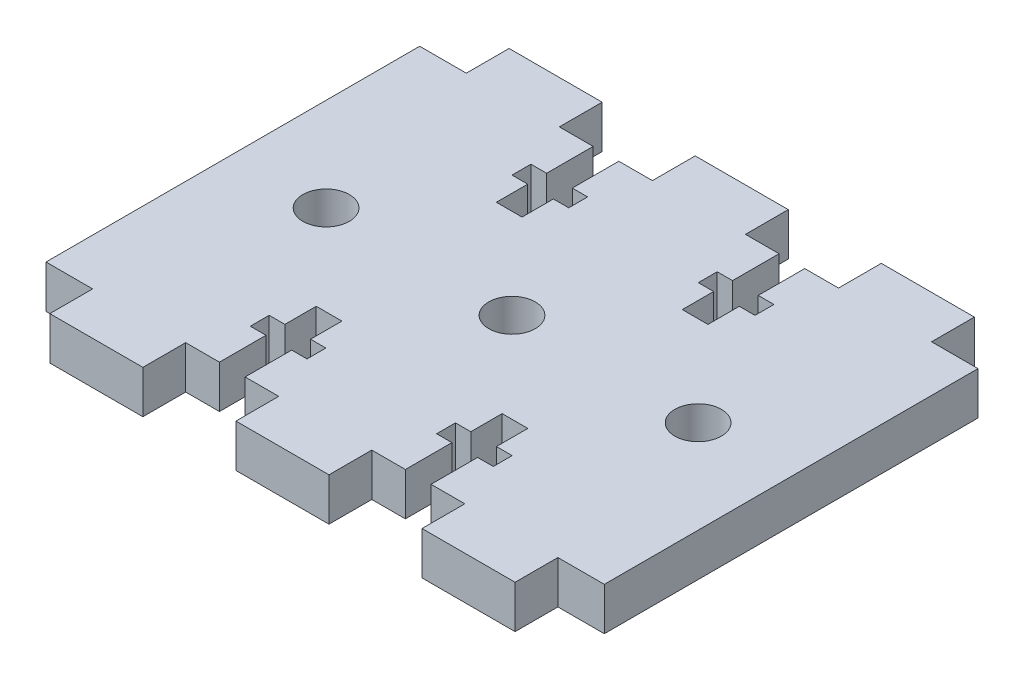
from build123d import *

# Parameters (mm, degrees)
BOSS_EXTRUDE1_DEPTH = 5.842
SKETCH2_R           = 3.175
CUT_EXTRUDE1_DEPTH  = 50.679572542


with BuildPart() as part:
    # Sketch1 → Boss-Extrude1 (new body)
    with BuildSketch(Plane(origin=(0, 0, 0), x_dir=(1, 0, 0), z_dir=(0, 1, 0))):
        Polygon((38.1, -25.5), (31.762654816, -25.5), (31.762654816, -31.342), (19.062654816, -31.342), (19.062654816, -25.5), (14.4526, -25.5), (14.4526, -19.15), (16.594059632, -19.15), (16.594059632, -16.571875), (14.4526, -16.571875), (14.4526, -12.291999784), (10.9474, -12.291999784), (10.9474, -16.571875), (8.856559632, -16.571875), (8.856559632, -19.15), (10.9474, -19.15), (10.9474, -25.5), (6.362654816, -25.5), (6.362654816, -31.342), (-6.337345184, -31.342), (-6.337345184, -25.5), (-10.922090368, -25.5), (-10.922090368, -19.15), (-8.83125, -19.15), (-8.83125, -16.571875), (-10.922090368, -16.571875), (-10.922090368, -12.291999784), (-14.427290368, -12.291999784), (-14.427290368, -16.571875), (-16.56875, -16.571875), (-16.56875, -19.15), (-14.427290368, -19.15), (-14.427290368, -25.5), (-19.037345184, -25.5), (-19.037345184, -31.342), (-31.737345184, -31.342), (-31.737345184, -25.5), (-38.1, -25.5), (-38.1, 25.5), (-31.737345184, 25.5), (-31.737345184, 31.342), (-19.037345184, 31.342), (-19.037345184, 25.5), (-14.427290368, 25.5), (-14.427290368, 19.15), (-16.56875, 19.15), (-16.56875, 16.571875), (-14.427290368, 16.571875), (-14.427290368, 12.291999784), (-10.922090368, 12.291999784), (-10.922090368, 16.571875), (-8.83125, 16.571875), (-8.83125, 19.15), (-10.922090368, 19.15), (-10.922090368, 25.5), (-6.337345184, 25.5), (-6.337345184, 31.342), (6.362654816, 31.342), (6.362654816, 25.5), (10.9474, 25.5), (10.9474, 19.15), (8.856559632, 19.15), (8.856559632, 16.571875), (10.9474, 16.571875), (10.9474, 12.291999784), (14.4526, 12.291999784), (14.4526, 16.571875), (16.594059632, 16.571875), (16.594059632, 19.15), (14.4526, 19.15), (14.4526, 25.5), (19.062654816, 25.5), (19.062654816, 31.342), (31.762654816, 31.342), (31.762654816, 25.5), (38.1, 25.5), align=None)
    extrude(amount=BOSS_EXTRUDE1_DEPTH)

    # Sketch2 → Cut-Extrude1 (cut, through all)
    with BuildSketch(Plane(origin=(0, 5.842, 0), x_dir=(1, 0, 0), z_dir=(0, 1, 0))):
        Circle(SKETCH2_R)
        with Locations((25.4, 0)):
            Circle(SKETCH2_R)
        with Locations((-25.374690368, 0)):
            Circle(SKETCH2_R)
    extrude(amount=-CUT_EXTRUDE1_DEPTH, mode=Mode.SUBTRACT)


solid = part.part
